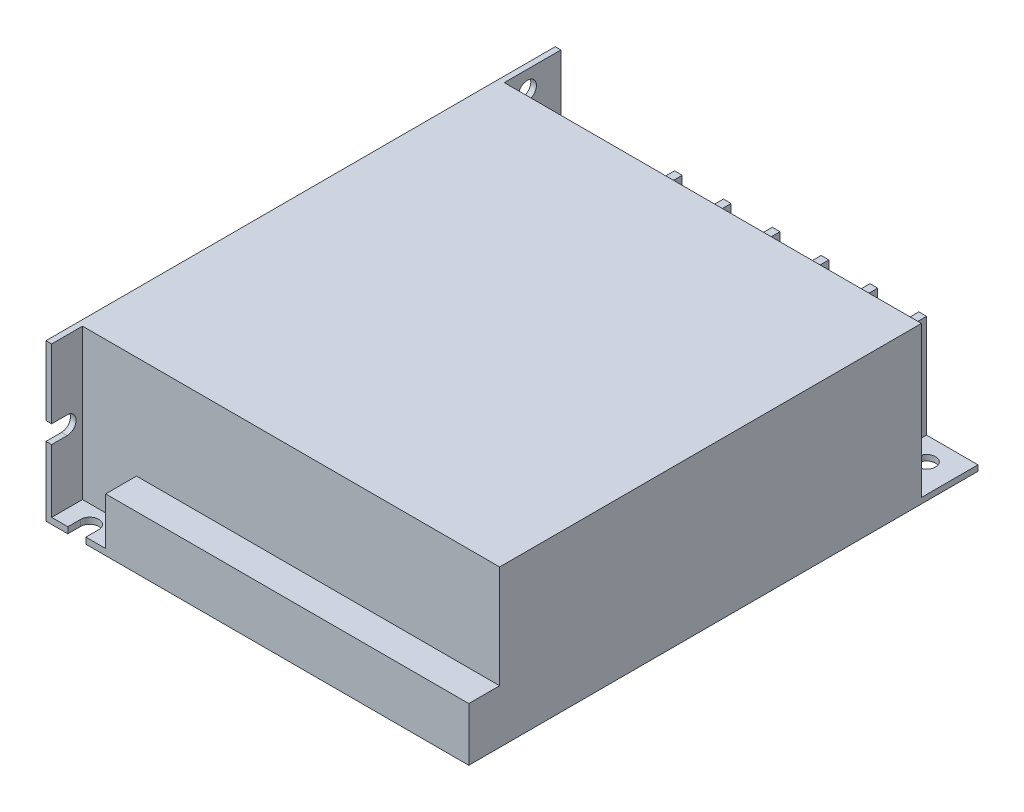
from build123d import *

# Parameters (mm, degrees)
SKETCH_1_W          = 82.2
SKETCH_1_H          = 99
EXTRUDE_1_DEPTH     = 30.4
SKETCH_3_W          = 81.1
SKETCH_3_H          = 6
CUT_EXTRUDE_1_DEPTH = 20
SKETCH_4_R          = 1.5
CUT_EXTRUDE_2_DEPTH = 3
SKETCH_5_R          = 1.75
CUT_EXTRUDE_3_DEPTH = 133.219514445
SKETCH_6_W          = 81.1
SKETCH_6_H          = 11
CUT_EXTRUDE_4_DEPTH = 29.3
SKETCH_7_R          = 1.75
CUT_EXTRUDE_5_DEPTH = 3
SKETCH_8_W          = 49
SKETCH_8_H          = 11
EXTRUDE_2_DEPTH     = 20
SKETCH_9_W          = 22.1
SKETCH_9_H          = 11
EXTRUDE_3_DEPTH     = 5.5
SKETCH_10_W         = 8
SKETCH_10_H         = 11
CUT_EXTRUDE_6_DEPTH = 8
SKETCH_11_R         = 3.25
EXTRUDE_4_DEPTH     = 4.5
FILLET_1_R          = 2
SKETCH_12_R         = 1.75
CUT_EXTRUDE_7_DEPTH = 4.5
SKETCH_13_W         = 10.5
SKETCH_13_H         = 6
CUT_EXTRUDE_8_DEPTH = 9.2
CUT_EXTRUDE_9_DEPTH = 133.219514445


with BuildPart() as part:
    # 草圖1 → 填料-伸長1 (new body)
    with BuildSketch(Plane(origin=(0, 0, 0), x_dir=(1, 0, 0), z_dir=(0, 1, 0))):
        with Locations((41.1, 49.5)):
            Rectangle(SKETCH_1_W, SKETCH_1_H)
    extrude(amount=EXTRUDE_1_DEPTH)

    # 草圖3 → 除料-伸長1 (cut)
    with BuildSketch(Plane(origin=(0, 30.4, 0), x_dir=(1, 0, 0), z_dir=(0, 1, 0))):
        with Locations((41.65, 3)):
            Rectangle(SKETCH_3_W, SKETCH_3_H)
    extrude(amount=-CUT_EXTRUDE_1_DEPTH, mode=Mode.SUBTRACT)

    # 草圖4 → 除料-伸長2 (cut)
    with BuildSketch(Plane.XZ):
        with Locations((40.5, -23.5)):
            Circle(SKETCH_4_R)
        with Locations((40.5, -78.5)):
            Circle(SKETCH_4_R)
    extrude(amount=-CUT_EXTRUDE_2_DEPTH, mode=Mode.SUBTRACT)

    # 草圖5 → 除料-伸長3 (cut, through all)
    with BuildSketch(Plane.XZ):
        with Locations((76.7, -94.5)):
            Circle(SKETCH_5_R)
    extrude(amount=-CUT_EXTRUDE_3_DEPTH, mode=Mode.SUBTRACT)

    # 草圖6 → 除料-伸長4 (cut)
    with BuildSketch(Plane(origin=(0, 30.4, 0), x_dir=(1, 0, 0), z_dir=(0, 1, 0))):
        with Locations((41.65, 93.5)):
            Rectangle(SKETCH_6_W, SKETCH_6_H)
    extrude(amount=-CUT_EXTRUDE_4_DEPTH, mode=Mode.SUBTRACT)

    # 草圖7 → 除料-伸長5 (cut)
    with BuildSketch(Plane.ZY):
        with Locations((-89, 15.2)):
            Circle(SKETCH_7_R)
        with Locations((-15, 15.2)):
            Circle(SKETCH_7_R)
        with BuildLine():
            Line((-3, 16.95), (0, 16.95))
            Line((0, 16.95), (0, 13.45))
            Line((0, 13.45), (-3, 13.45))
            ThreePointArc((-3, 13.45), (-4.75, 15.2), (-3, 16.95))
        make_face()
    extrude(amount=-CUT_EXTRUDE_5_DEPTH, mode=Mode.SUBTRACT)

    # 草圖8 → 填料-伸長2 (add)
    with BuildSketch(Plane(origin=(0, 1.1, 0), x_dir=(1, 0, 0), z_dir=(0, 1, 0))):
        with Locations((47.7, 93.5)):
            Rectangle(SKETCH_8_W, SKETCH_8_H)
    extrude(amount=EXTRUDE_2_DEPTH)

    # 草圖9 → 填料-伸長3 (add)
    with BuildSketch(Plane(origin=(0, 1.1, 0), x_dir=(1, 0, 0), z_dir=(0, 1, 0))):
        with Locations((12.15, 93.5)):
            Rectangle(SKETCH_9_W, SKETCH_9_H)
    extrude(amount=EXTRUDE_3_DEPTH)

    # 草圖10 → 除料-伸長6 (cut)
    with BuildSketch(Plane(origin=(0, 21.1, 0), x_dir=(1, 0, 0), z_dir=(0, 1, 0))):
        with Locations((28.7, 93.5)):
            Rectangle(SKETCH_10_W, SKETCH_10_H)
        with Locations((38.2, 93.5)):
            Rectangle(SKETCH_10_W, SKETCH_10_H)
        with Locations((47.7, 93.5)):
            Rectangle(SKETCH_10_W, SKETCH_10_H)
        with Locations((57.2, 93.5)):
            Rectangle(SKETCH_10_W, SKETCH_10_H)
        with Locations((66.7, 93.5)):
            Rectangle(SKETCH_10_W, SKETCH_10_H)
    extrude(amount=-CUT_EXTRUDE_6_DEPTH, mode=Mode.SUBTRACT)

    # 草圖11 → 填料-伸長4 (add)
    with BuildSketch(Plane(origin=(0, 13.1, 0), x_dir=(1, 0, 0), z_dir=(0, 1, 0))):
        with Locations((66.7, 93.5)):
            Circle(SKETCH_11_R)
        with Locations((57.2, 93.5)):
            Circle(SKETCH_11_R)
        with Locations((47.7, 93.5)):
            Circle(SKETCH_11_R)
        with Locations((38.2, 93.5)):
            Circle(SKETCH_11_R)
        with Locations((28.7, 93.5)):
            Circle(SKETCH_11_R)
    extrude(amount=EXTRUDE_4_DEPTH)

    # 圓角1
    fillet_1_edges = [part.edges().sort_by_distance(p)[0] for p in [
        (25.45, 17.6, -93.5),
        (34.95, 17.6, -93.5),
        (44.45, 17.6, -93.5),
        (53.95, 17.6, -93.5),
        (63.45, 17.6, -93.5),
    ]]
    fillet(fillet_1_edges, radius=FILLET_1_R)

    # 草圖12 → 除料-伸長7 (cut)
    with BuildSketch(Plane.ZY):
        with Locations((-92.5, 26.8)):
            Circle(SKETCH_12_R)
    extrude(amount=-CUT_EXTRUDE_7_DEPTH, mode=Mode.SUBTRACT)

    # 草圖13 → 除料-伸長8 (cut)
    with BuildSketch(Plane(origin=(0, 10.4, 0), x_dir=(1, 0, 0), z_dir=(0, 1, 0))):
        with Locations((6.35, 3)):
            Rectangle(SKETCH_13_W, SKETCH_13_H)
    extrude(amount=-CUT_EXTRUDE_8_DEPTH, mode=Mode.SUBTRACT)

    # 草圖14 → 除料-伸長9 (cut, through all)
    with BuildSketch(Plane.XZ):
        with BuildLine():
            Line((7.75, -2.5), (7.75, 0))
            Line((7.75, 0), (4.25, 0))
            Line((4.25, 0), (4.25, -2.5))
            ThreePointArc((4.25, -2.5), (6, -4.25), (7.75, -2.5))
        make_face()
    extrude(amount=-CUT_EXTRUDE_9_DEPTH, mode=Mode.SUBTRACT)


solid = part.part
